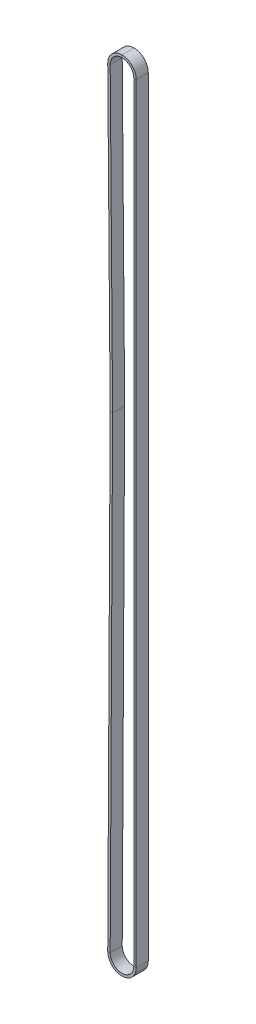
from build123d import *

# Parameters (mm, degrees)
SKETCH3_W = 7.366
SKETCH3_H = 1.5


with BuildPart() as part:
    # Sweep1: sweep along a path in Sketch2
    with BuildLine(Plane.XY) as sweep1_path:
        Line((-7.217959412, 0.037533359), (-5.727035895, 286.753819557))
        ThreePointArc((-5.727035895, 286.753819557), (-5.72700281, 286.771488202), (-5.727087308, 286.789156677))
        Line((-5.727087308, 286.789156677), (-7.217819636, 470.60346355))
        ThreePointArc((-7.217819636, 470.60346355), (-0.029268466, 477.879997657), (7.218056998, 470.662))
        Line((7.218056998, 470.662), (7.218056998, 0))
        ThreePointArc((7.218056998, 0), (-0.018766743, -7.218032601), (-7.217959412, 0.037533359))
    # Sketch3 → Sweep1 (sweep)
    with BuildSketch(Plane(origin=(0, 0, 0), x_dir=(0, 0, -1), z_dir=(1, 0, 0))):
        with Locations((3.683, 478.630056998)):
            Rectangle(SKETCH3_W, SKETCH3_H)
    sweep(path=sweep1_path.line)


solid = part.part
